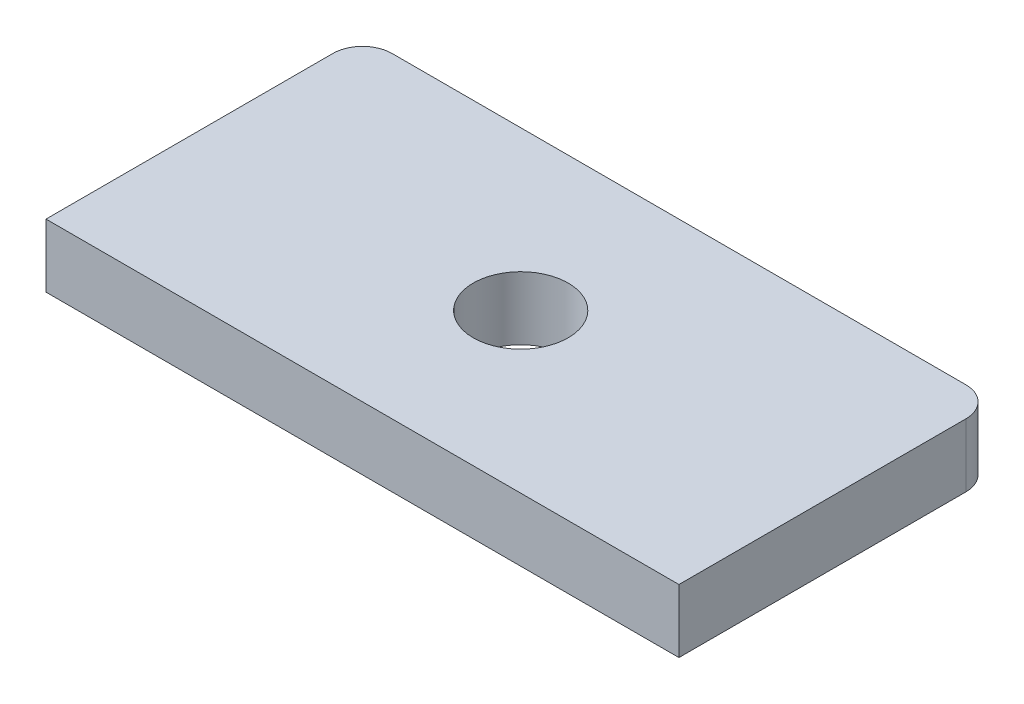
from build123d import *

# Parameters (mm, degrees)
SKETCH1_W          = 80
SKETCH1_H          = 40
BASE_FLANGE1_DEPTH = 8
SKETCH6_R          = 6
CUT_EXTRUDE1_DEPTH = 10
FILLET1_R          = 3.74


# Sheet-metal steps are written as plain solids
with BuildPart() as part:
    # Sketch1 → Base-Flange1 (new body)
    with BuildSketch(Plane(origin=(0, 0, 0), x_dir=(1, 0, 0), z_dir=(0, 1, 0))):
        Rectangle(SKETCH1_W, SKETCH1_H)
    extrude(amount=-BASE_FLANGE1_DEPTH)

    # Sketch6 → Cut-Extrude1 (cut)
    with BuildSketch(Plane(origin=(0, 0, 0), x_dir=(1, 0, 0), z_dir=(0, 1, 0))):
        with Locations(Location((0, 0, 0), (0, 0, 270))):
            Circle(SKETCH6_R)
    extrude(amount=-CUT_EXTRUDE1_DEPTH, mode=Mode.SUBTRACT)

    # Fillet1
    fillet1_edges = [part.edges().sort_by_distance(p)[0] for p in [
        (-40, -4, -20),
        (40, -4, -20),
    ]]
    fillet(fillet1_edges, radius=FILLET1_R)


solid = part.part
